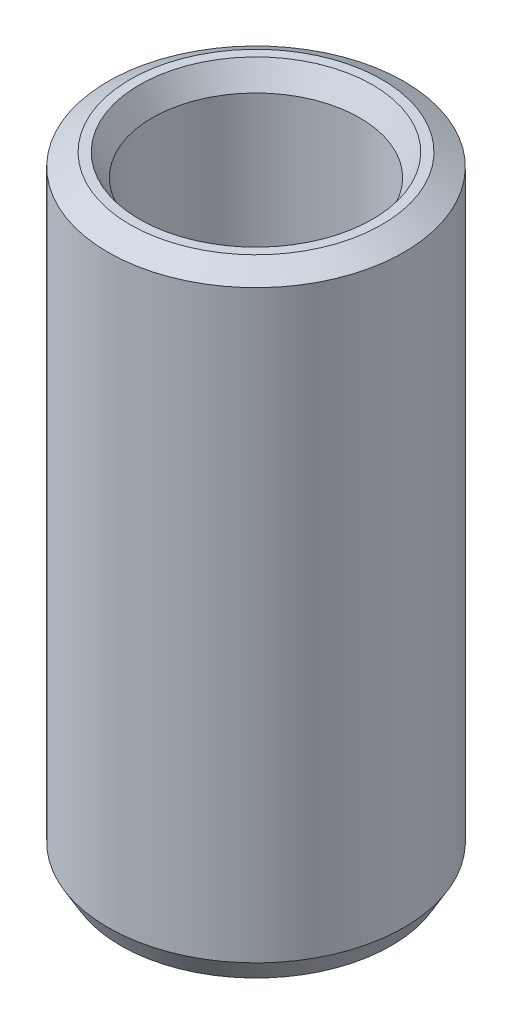
from build123d import *
from OCP.BRepFilletAPI import BRepFilletAPI_MakeChamfer

# Parameters (mm, degrees)
SKETCH1_R           = 32.5
BOSS_EXTRUDE1_DEPTH = 136.073168395
SKETCH2_R           = 22.772874197
CUT_EXTRUDE1_DEPTH  = 144.625927872
CHAMFER1_SIZE       = 2.810006741
CHAMFER1_SIZE2      = 4.867074445


with BuildPart() as part:
    # Sketch1 → Boss-Extrude1 (new body)
    with BuildSketch(Plane(origin=(0, 0, 0), x_dir=(1, 0, 0), z_dir=(0, 1, 0))):
        Circle(SKETCH1_R)
    extrude(amount=BOSS_EXTRUDE1_DEPTH)

    # Sketch2 → Cut-Extrude1 (cut, through all)
    with BuildSketch(Plane(origin=(0, 0, 0), x_dir=(1, 0, 0), z_dir=(0, 1, 0))):
        Circle(SKETCH2_R)
    extrude(amount=CUT_EXTRUDE1_DEPTH, mode=Mode.SUBTRACT)

    # Chamfer1: one chamfer whose edges measure the first distance from different faces: ONE call of the kernel's chamfer builder (chamfer() names one face for all edges)
    chamfer1_edges_1 = [part.edges().sort_by_distance(p)[0] for p in [
        (-22.772874197, 136.073168395, 0),
    ]]
    chamfer1_side_1 = [part.faces().sort_by_distance(p)[0] for p in [
        (-31.580761184, 136.073168395, 0),
    ]]
    chamfer1_edges_2 = [part.edges().sort_by_distance(p)[0] for p in [
        (-22.772874197, 0, 0),
    ]]
    chamfer1_side_2 = [part.faces().sort_by_distance(p)[0] for p in [
        (-22.772874197, 68.036584198, 0),
    ]]
    chamfer1_edges_3 = [part.edges().sort_by_distance(p)[0] for p in [
        (-32.5, 0, 0),
    ]]
    chamfer1_side_3 = [part.faces().sort_by_distance(p)[0] for p in [
        (-31.580761184, 0, 0),
    ]]
    chamfer1_edges_4 = [part.edges().sort_by_distance(p)[0] for p in [
        (-32.5, 136.073168395, 0),
    ]]
    chamfer1_side_4 = [part.faces().sort_by_distance(p)[0] for p in [
        (-32.5, 68.036584198, 0),
    ]]
    chamfer1 = BRepFilletAPI_MakeChamfer(part.part.solid().wrapped)
    for e in chamfer1_edges_1:
        chamfer1.Add(CHAMFER1_SIZE, CHAMFER1_SIZE2, e.wrapped, chamfer1_side_1[0].wrapped)  # the first distance lies on this face
    for e in chamfer1_edges_2:
        chamfer1.Add(CHAMFER1_SIZE, CHAMFER1_SIZE2, e.wrapped, chamfer1_side_2[0].wrapped)  # the first distance lies on this face
    for e in chamfer1_edges_3:
        chamfer1.Add(CHAMFER1_SIZE, CHAMFER1_SIZE2, e.wrapped, chamfer1_side_3[0].wrapped)  # the first distance lies on this face
    for e in chamfer1_edges_4:
        chamfer1.Add(CHAMFER1_SIZE, CHAMFER1_SIZE2, e.wrapped, chamfer1_side_4[0].wrapped)  # the first distance lies on this face
    add(Compound.cast(chamfer1.Shape()), mode=Mode.REPLACE)


solid = part.part
